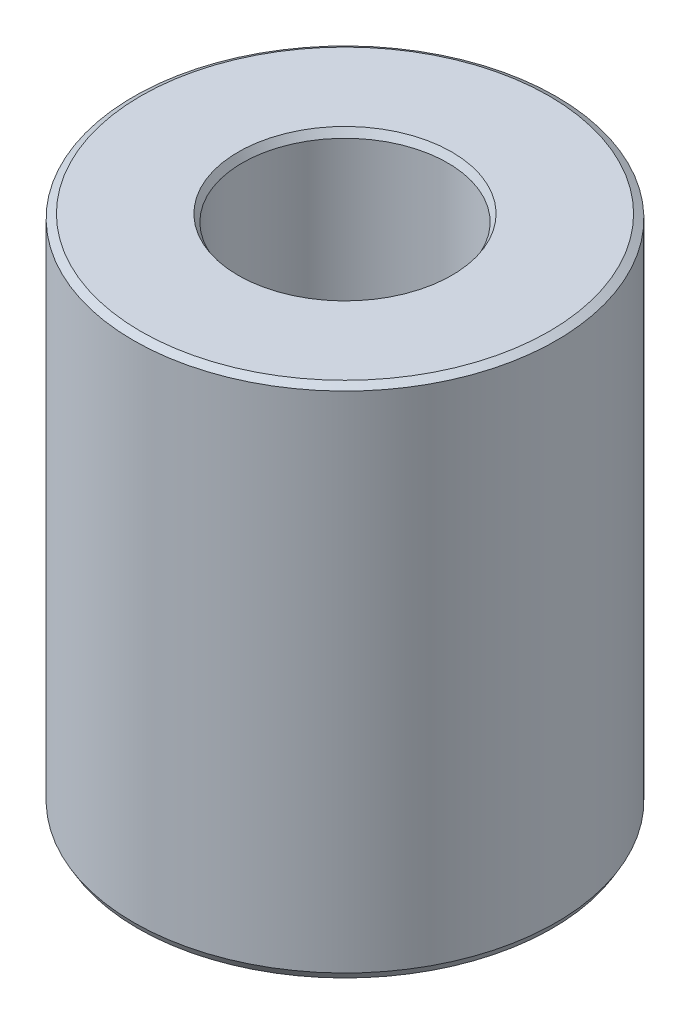
from build123d import *
from OCP.BRepFilletAPI import BRepFilletAPI_MakeChamfer

# Parameters (mm, degrees)
SKETCH1_R           = 20
BOSS_EXTRUDE1_DEPTH = 48.77760728
SKETCH2_R           = 9.714866497
CUT_EXTRUDE1_DEPTH  = 57.384882477
CHAMFER1_SIZE       = 0.397797873
CHAMFER1_SIZE2      = 0.689006127


with BuildPart() as part:
    # Sketch1 → Boss-Extrude1 (new body)
    with BuildSketch(Plane(origin=(0, 0, 0), x_dir=(1, 0, 0), z_dir=(0, 1, 0))):
        Circle(SKETCH1_R)
    extrude(amount=BOSS_EXTRUDE1_DEPTH)

    # Sketch2 → Cut-Extrude1 (cut, through all)
    with BuildSketch(Plane(origin=(0, 0, 0), x_dir=(1, 0, 0), z_dir=(0, 1, 0))):
        Circle(SKETCH2_R)
    extrude(amount=CUT_EXTRUDE1_DEPTH, mode=Mode.SUBTRACT)

    # Chamfer1: one chamfer whose edges measure the first distance from different faces: ONE call of the kernel's chamfer builder (chamfer() names one face for all edges)
    chamfer1_edges_1 = [part.edges().sort_by_distance(p)[0] for p in [
        (-9.714866497, 48.77760728, 0),
    ]]
    chamfer1_side_1 = [part.faces().sort_by_distance(p)[0] for p in [
        (-19.434314575, 48.77760728, 0),
    ]]
    chamfer1_edges_2 = [part.edges().sort_by_distance(p)[0] for p in [
        (-9.714866497, 0, 0),
    ]]
    chamfer1_side_2 = [part.faces().sort_by_distance(p)[0] for p in [
        (-9.714866497, 24.38880364, 0),
    ]]
    chamfer1_edges_3 = [part.edges().sort_by_distance(p)[0] for p in [
        (-20, 0, 0),
    ]]
    chamfer1_side_3 = [part.faces().sort_by_distance(p)[0] for p in [
        (-19.434314575, 0, 0),
    ]]
    chamfer1_edges_4 = [part.edges().sort_by_distance(p)[0] for p in [
        (-20, 48.77760728, 0),
    ]]
    chamfer1_side_4 = [part.faces().sort_by_distance(p)[0] for p in [
        (-20, 24.38880364, 0),
    ]]
    chamfer1 = BRepFilletAPI_MakeChamfer(part.part.solid().wrapped)
    for e in chamfer1_edges_1:
        chamfer1.Add(CHAMFER1_SIZE, CHAMFER1_SIZE2, e.wrapped, chamfer1_side_1[0].wrapped)  # the first distance lies on this face
    for e in chamfer1_edges_2:
        chamfer1.Add(CHAMFER1_SIZE, CHAMFER1_SIZE2, e.wrapped, chamfer1_side_2[0].wrapped)  # the first distance lies on this face
    for e in chamfer1_edges_3:
        chamfer1.Add(CHAMFER1_SIZE, CHAMFER1_SIZE2, e.wrapped, chamfer1_side_3[0].wrapped)  # the first distance lies on this face
    for e in chamfer1_edges_4:
        chamfer1.Add(CHAMFER1_SIZE, CHAMFER1_SIZE2, e.wrapped, chamfer1_side_4[0].wrapped)  # the first distance lies on this face
    add(Compound.cast(chamfer1.Shape()), mode=Mode.REPLACE)


solid = part.part
